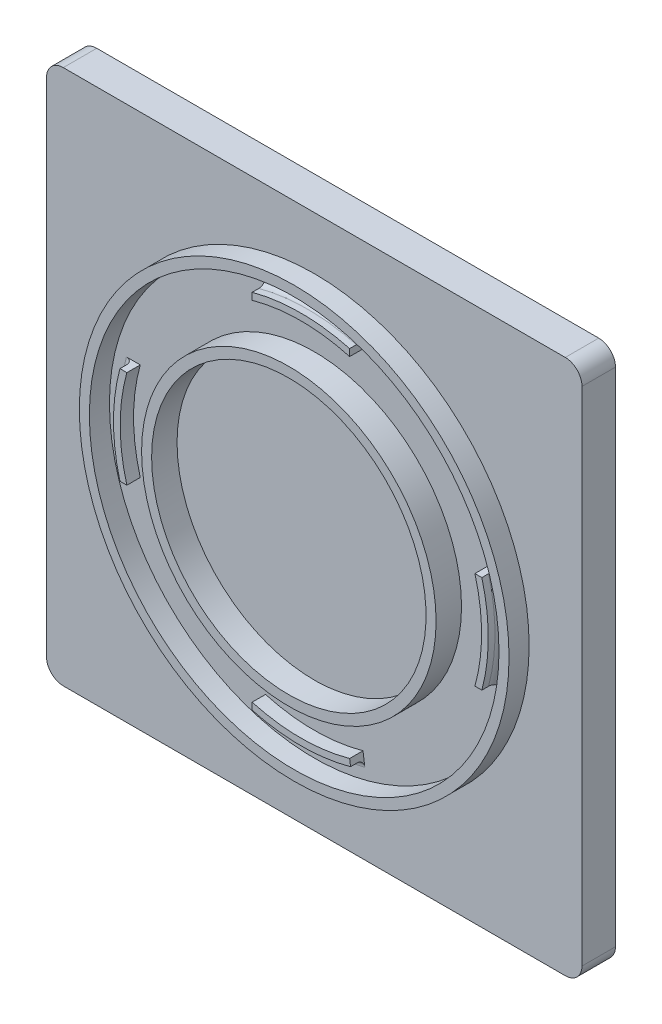
from build123d import *

# Parameters (mm, degrees)
SKETCH1_W           = 80
SKETCH1_H           = 80
BOSS_EXTRUDE1_DEPTH = 5
FILLET1_R           = 2.5
BOSS_EXTRUDE5_DEPTH = 2
FILLET2_R           = 1
SKETCH10_R          = 22
SKETCH10_R_2        = 20.5
BOSS_EXTRUDE7_DEPTH = 3.8
SKETCH12_R          = 32.1
SKETCH12_R_2        = 30.6
BOSS_EXTRUDE8_DEPTH = 3


with BuildPart() as part:
    # Sketch1 → Boss-Extrude1 (new body)
    with BuildSketch(Plane.XY):
        Rectangle(SKETCH1_W, SKETCH1_H)
    extrude(amount=BOSS_EXTRUDE1_DEPTH)

    # Fillet1
    fillet1_edges = [part.edges().sort_by_distance(p)[0] for p in [
        (40, 40, 2.5),
        (-40, 40, 2.5),
        (40, -40, 2.5),
        (-40, -40, 2.5),
    ]]
    fillet(fillet1_edges, radius=FILLET1_R)

    # Sketch5 → Boss-Extrude5 (add)
    with BuildSketch(Plane.XY.offset(5)):
        with BuildLine():
            Line((-7.284172662, -25.998862064), (-7.284172662, -27.035917381))
            ThreePointArc((-7.284172662, -27.035917381), (0.070639835, -27.999910893), (7.4204947, -26.998819574))
            Line((7.4204947, -26.998819574), (7.284172662, -25.998862064))
            ThreePointArc((7.284172662, -25.998862064), (0, -27), (-7.284172662, -25.998862064))
        make_face()
        with BuildLine():
            Line((-7.284172662, 27.035917381), (-7.284172662, 25.998862064))
            ThreePointArc((-7.284172662, 25.998862064), (0, 27), (7.284172662, 25.998862064))
            Line((7.284172662, 25.998862064), (7.284172662, 27.035917381))
            ThreePointArc((7.284172662, 27.035917381), (0, 28), (-7.284172662, 27.035917381))
        make_face()
        with BuildLine():
            Line((-27.035917381, 7.284172662), (-25.998862064, 7.284172662))
            ThreePointArc((-25.998862064, 7.284172662), (-27, 0), (-25.998862064, -7.284172662))
            Line((-25.998862064, -7.284172662), (-27.035917381, -7.284172662))
            ThreePointArc((-27.035917381, -7.284172662), (-28, 0), (-27.035917381, 7.284172662))
        make_face()
        with BuildLine():
            Line((25.998862064, -7.284172662), (27.035917381, -7.284172662))
            ThreePointArc((27.035917381, -7.284172662), (28, 0), (27.035917381, 7.284172662))
            Line((27.035917381, 7.284172662), (25.998862064, 7.284172662))
            ThreePointArc((25.998862064, 7.284172662), (27, 0), (25.998862064, -7.284172662))
        make_face()
    extrude(amount=BOSS_EXTRUDE5_DEPTH)

    # Fillet2
    fillet2_edges = [part.edges().sort_by_distance(p)[0] for p in [
        (-28, 0, 5),
        (0, 28, 5),
        (28, 0, 5),
        (0.070639835, -27.999910893, 5),
    ]]
    fillet(fillet2_edges, radius=FILLET2_R)

    # Sketch10 → Boss-Extrude7 (add)
    with BuildSketch(Plane.XY.offset(5)):
        Circle(SKETCH10_R)
        Circle(SKETCH10_R_2, mode=Mode.SUBTRACT)
    extrude(amount=BOSS_EXTRUDE7_DEPTH)

    # Sketch12 → Boss-Extrude8 (add)
    with BuildSketch(Plane.XY.offset(5)):
        Circle(SKETCH12_R)
        Circle(SKETCH12_R_2, mode=Mode.SUBTRACT)
    extrude(amount=BOSS_EXTRUDE8_DEPTH)


solid = part.part
